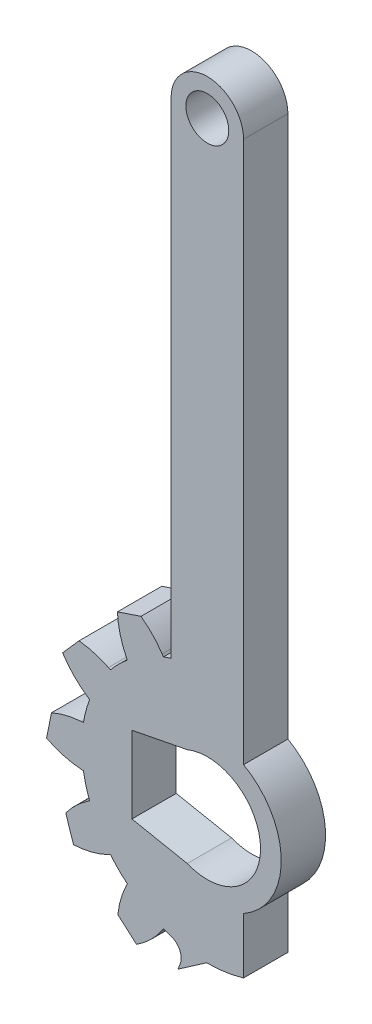
from build123d import *

# Parameters (mm, degrees)
SKETCH1_R           = 1.45
BOSS_EXTRUDE1_DEPTH = 3
CUT_EXTRUDE2_DEPTH  = 46.173463436
SKETCH5_W           = 3.6
SKETCH5_H           = 3
FILLET1_R           = 1


with BuildPart() as part:
    # Sketch1 → Boss-Extrude1 (new body)
    with BuildSketch(Plane.XY.offset(1.9)):
        with BuildLine():
            Line((2.45, -8.139256723), (2.45, -4.358612164))
            ThreePointArc((2.45, -4.358612164), (5, 0), (2.45, 4.358612164))
            Line((2.45, 4.358612164), (2.45, 41))
            ThreePointArc((2.45, 41), (0, 43.45), (-2.45, 41))
            Line((-2.45, 41), (-2.45, 8.139256723))
            ThreePointArc((-2.45, 8.139256723), (-2.710254715, 8.056334116), (-2.967710696, 7.965092167))
            Line((-2.967710696, 7.965092167), (-3.054167872, 8.093270203))
            ThreePointArc((-3.054167872, 8.093270203), (-4.342095244, 9.472160372), (-5.994566265, 10.382893341))
            ThreePointArc((-5.994566265, 10.382893341), (-6.032083889, 8.496444973), (-5.481893659, 6.691622066))
            Line((-5.481893659, 6.691622066), (-5.414116812, 6.552658937))
            ThreePointArc((-5.414116812, 6.552658937), (-6.01040764, 6.01040764), (-6.552658937, 5.414116812))
            Line((-6.552658937, 5.414116812), (-6.691622066, 5.481893659))
            ThreePointArc((-6.691622066, 5.481893659), (-8.496444973, 6.032083889), (-10.382893341, 5.994566265))
            ThreePointArc((-10.382893341, 5.994566265), (-9.472160372, 4.342095244), (-8.093270203, 3.054167872))
            Line((-8.093270203, 3.054167872), (-7.965092167, 2.967710696))
            ThreePointArc((-7.965092167, 2.967710696), (-8.210369523, 2.199961883), (-8.381827508, 1.41243323))
            Line((-8.381827508, 1.41243323), (-8.536061531, 1.401648136))
            ThreePointArc((-8.536061531, 1.401648136), (-10.374179133, 0.975715399), (-11.989132531, 0))
            ThreePointArc((-11.989132531, 0), (-10.374179133, -0.975715399), (-8.536061531, -1.401648136))
            Line((-8.536061531, -1.401648136), (-8.381827508, -1.41243323))
            ThreePointArc((-8.381827508, -1.41243323), (-8.210369523, -2.199961883), (-7.965092167, -2.967710696))
            Line((-7.965092167, -2.967710696), (-8.093270203, -3.054167872))
            ThreePointArc((-8.093270203, -3.054167872), (-9.472160372, -4.342095244), (-10.382893341, -5.994566265))
            ThreePointArc((-10.382893341, -5.994566265), (-8.496444973, -6.032083889), (-6.691622066, -5.481893659))
            Line((-6.691622066, -5.481893659), (-6.552658937, -5.414116812))
            ThreePointArc((-6.552658937, -5.414116812), (-6.01040764, -6.01040764), (-5.414116812, -6.552658937))
            Line((-5.414116812, -6.552658937), (-5.481893659, -6.691622066))
            ThreePointArc((-5.481893659, -6.691622066), (-6.032083889, -8.496444973), (-5.994566265, -10.382893341))
            ThreePointArc((-5.994566265, -10.382893341), (-4.342095244, -9.472160372), (-3.054167872, -8.093270203))
            Line((-3.054167872, -8.093270203), (-2.967710696, -7.965092167))
            ThreePointArc((-2.967710696, -7.965092167), (-2.212026244, -8.207127384), (-1.437064557, -8.377639611))
            Line((-1.437064557, -8.377639611), (-1.984198903, -9.839001099))
            Line((-1.984198903, -9.839001099), (-0.052960828, -8.499835007))
            ThreePointArc((-0.052960828, -8.499835007), (1.212003867, -8.413147249), (2.45, -8.139256723))
        make_face()
        with Locations((0, 41)):
            Circle(SKETCH1_R, mode=Mode.SUBTRACT)
    extrude(amount=-BOSS_EXTRUDE1_DEPTH)

    # Sketch4 → Cut-Extrude2 (cut, through all)
    with BuildSketch(Plane.XY.offset(1.9)):
        with BuildLine():
            Line((-5.102940329, -2.6), (-1.358771093, -3.333727811))
            ThreePointArc((-1.358771093, -3.333727811), (-3.6, 0), (-1.358771093, 3.333727811))
            Line((-1.358771093, 3.333727811), (-5.102940329, 2.6))
            Line((-5.102940329, 2.6), (-5.102940329, -2.6))
        make_face()
    extrude(amount=-CUT_EXTRUDE2_DEPTH, mode=Mode.SUBTRACT)

    # Sketch5 → Cut-Revolve1 (revolve, cut)
    with BuildSketch(Plane(origin=(0, 0, 0), x_dir=(1, 0, 0), z_dir=(0, 1, 0))):
        with Locations((1.8, -0.4)):
            Rectangle(SKETCH5_W, SKETCH5_H)
    revolve(axis=Axis((0, 0, -1.1), (0, 0, 1)), mode=Mode.SUBTRACT)

    # Chamfer1
    # the kernel refuses this chamfer: 1.996823512, 1.412365401 mm, written as the material it takes off along each edge
    with BuildSketch(Plane(origin=(-5.994566265, -10.382893341, 6.307600342), x_dir=(0.8971018613244867, 0.44182377754953556, 0), z_dir=(0, 0, -1)), Plane(origin=(-10.382893341, -5.994566265, 6.307600342), x_dir=(0.9978248904640776, -0.06592031530834441, 0), z_dir=(0, 0, -1)), Plane(origin=(-11.989132531, 0, 6.307600342), x_dir=(0.8311815460161395, -0.5560011129145519, 0), z_dir=(0, 0, -1)), Plane(origin=(-10.382893341, 5.994566265, 6.307600342), x_dir=(0.4418237775496057, -0.8971018613244522, 0), z_dir=(0, 0, -1)), Plane(origin=(-5.994566265, 10.382893341, 6.307600342), x_dir=(-0.06592031530837167, -0.9978248904640757, 0), z_dir=(0, 0, -1))) as chamfer1_piece_1:
        with BuildLine():
            Line((1.33889649, 0), (0.700148491, -1.556942978))
            ThreePointArc((0.700148491, -1.556942978), (0.305807457, -0.828670891), (0, 0))
            ThreePointArc((0, 0), (0.684607685, 0.037444556), (1.33889649, 0))
        make_face()
    extrude(amount=11.815200684, mode=Mode.SUBTRACT)

    # Fillet1
    fillet1_edges = [part.edges().sort_by_distance(p)[0] for p in [
        (-1.437064557, -8.377639611, 0.4),
    ]]
    fillet(fillet1_edges, radius=FILLET1_R)


solid = part.part
